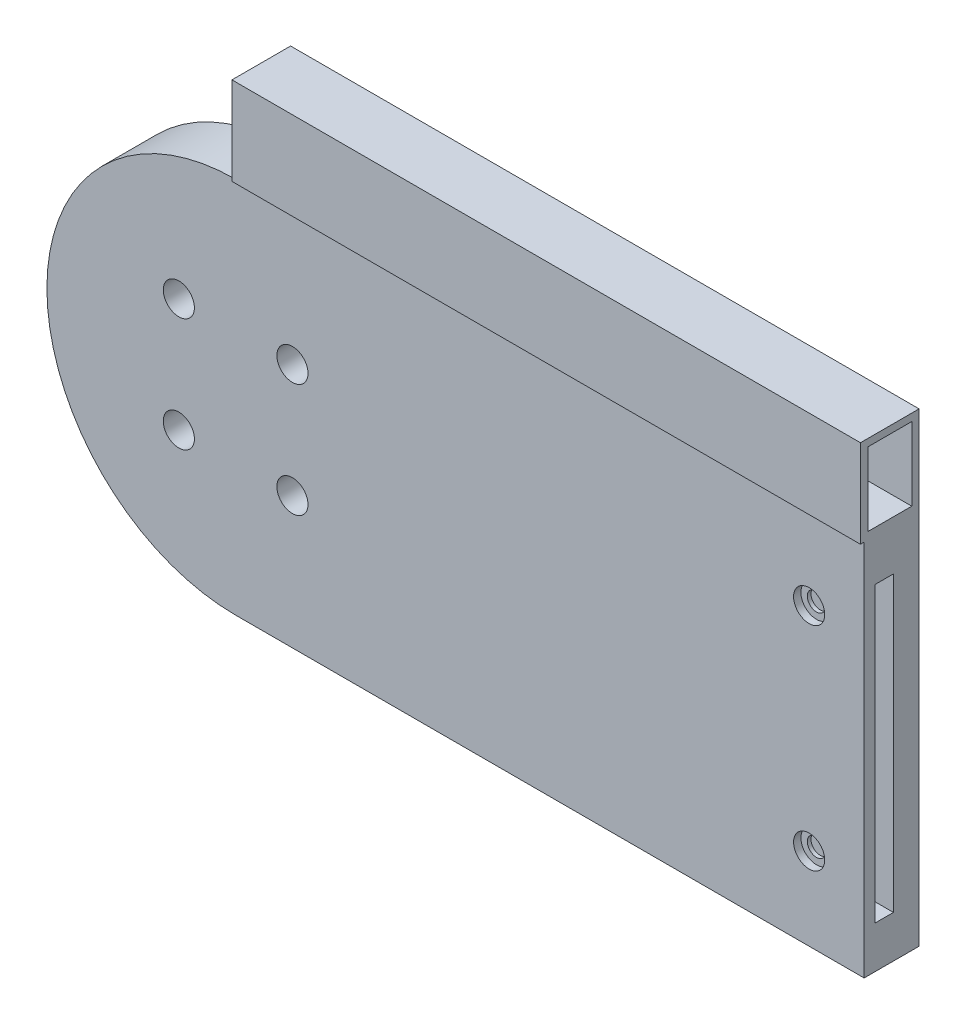
from build123d import *

# Parameters (mm, degrees)
CROQUIS1_W                        = 103
CROQUIS1_H                        = 103
CROQUIS1_R                        = 2.5
SALIENTE_EXTRUIR1_DEPTH           = 15
REDONDEO2_R                       = 51.5
CROQUIS2_W                        = 15
CROQUIS2_H                        = 103
SALIENTE_EXTRUIR2_DEPTH           = 120
CROQUIS3_R                        = 4.25
CORTAR_EXTRUIR1_DEPTH             = 8
SALIENTE_EXTRUIR3_START           = -223
SALIENTE_EXTRUIR3_DEPTH           = 223
CORTAR_EXTRUIR2_DEPTH             = 181.53669987
CORTAR_EXTRUIR2_DEPTH_BACK        = 181.53669987
REDONDEO3_START                   = -23.965772234
REDONDEO3_DEPTH                   = 195.465772234
REDONDEO3_START_2                 = -45.024993159
REDONDEO3_2_DEPTH                 = 21.059220925
REDONDEO3_START_3                 = 15
REDONDEO3_3_DEPTH                 = 9
REDONDEO4_R                       = 10
CORTAR_EXTRUIR3_REACH             = 182.537
CROQUIS6_R                        = 4.25
CORTAR_EXTRUIR3_DIRECTION_2_DEPTH = 181.536699978
CORTAR_EXTRUIR4_DEPTH             = 231.022281636
CORTAR_EXTRUIR4_DEPTH_BACK        = 40
CROQUIS7_W                        = 5
CROQUIS7_H                        = 80
CROQUIS10_R                       = 4.25
CORTAR_EXTRUIR5_DEPTH             = 10
CROQUIS11_R                       = 2.5
CORTAR_EXTRUIR6_DEPTH             = 180.536904387
CROQUIS12_W                       = 16
CROQUIS12_H                       = 24
CROQUIS12_W_2                     = 12
CROQUIS12_H_2                     = 20
SALIENTE_EXTRUIR4_DEPTH           = 171.5
CORTAR_EXTRUIR7_DEPTH             = 4
CROQUIS14_W                       = 237.415318392
CROQUIS14_H                       = 103
CORTAR_EXTRUIR8_DEPTH             = 8


with BuildPart() as part:
    # Croquis1 → Saliente-Extruir1 (new body)
    with BuildSketch(Plane.XY):
        Rectangle(CROQUIS1_W, CROQUIS1_H)
        with Locations((15.5, 15.5)):
            Circle(CROQUIS1_R, mode=Mode.SUBTRACT)
        with Locations((-15.5, 15.5)):
            Circle(CROQUIS1_R, mode=Mode.SUBTRACT)
        with Locations((-15.5, -15.5)):
            Circle(CROQUIS1_R, mode=Mode.SUBTRACT)
        with Locations((15.5, -15.5)):
            Circle(CROQUIS1_R, mode=Mode.SUBTRACT)
    extrude(amount=SALIENTE_EXTRUIR1_DEPTH)

    # Redondeo2
    redondeo2_edges = [part.edges().sort_by_distance(p)[0] for p in [
        (-51.5, -51.5, 7.5),
        (-51.5, 51.5, 7.5),
    ]]
    fillet(redondeo2_edges, radius=REDONDEO2_R - 0.0001)  # a hair under: the kernel refuses the full size

    # Croquis2 → Saliente-Extruir2 (add)
    with BuildSketch(Plane(origin=(51.5, 0, 0), x_dir=(0, 0, -1), z_dir=(1, 0, 0))):
        with Locations((-7.5, 0)):
            Rectangle(CROQUIS2_W, CROQUIS2_H)
    extrude(amount=SALIENTE_EXTRUIR2_DEPTH)

    # Croquis3 → Cortar-Extruir1 (cut)
    with BuildSketch(Plane.XY.offset(15)):
        with Locations((-15.5, 15.5)):
            Circle(CROQUIS3_R)
        with Locations((15.5, 15.5)):
            Circle(CROQUIS3_R)
        with Locations((15.5, -15.5)):
            Circle(CROQUIS3_R)
        with Locations((-15.5, -15.5)):
            Circle(CROQUIS3_R)
    extrude(amount=-CORTAR_EXTRUIR1_DEPTH, mode=Mode.SUBTRACT)

    # Croquis4 → Saliente-Extruir3 (add)
    with BuildSketch(Plane(origin=(171.5, 0, 0), x_dir=(0, 0, -1), z_dir=(1, 0, 0)).offset(SALIENTE_EXTRUIR3_START)):
        Polygon((-15, -19), (-15, -25), (-23, -25), (-23, 25), (-15, 25), (-15, 19), (-19, 19), (-19, -19), align=None)
    extrude(amount=SALIENTE_EXTRUIR3_DEPTH)

    # Croquis5 → Cortar-Extruir2 (cut, two sides: drawn at the far end of the back side and taken through both)
    with BuildSketch(Plane(origin=(0, 0, 0), x_dir=(-1, 0, 0), z_dir=(0, 0, -1)).offset(-CORTAR_EXTRUIR2_DEPTH_BACK)):
        with BuildLine():
            Line((40.930864284, 31.255629077), (61.422564692, 30.315306135))
            Line((61.422564692, 30.315306135), (63.075048064, -35.056936027))
            Line((63.075048064, -35.056936027), (38.432028807, -34.281615507))
            ThreePointArc((38.432028807, -34.281615507), (48.122237498, -18.343943366), (51.5, 0))
            ThreePointArc((51.5, 0), (48.786214808, 16.497128377), (40.930864284, 31.255629077))
        make_face()
    extrude(amount=CORTAR_EXTRUIR2_DEPTH + CORTAR_EXTRUIR2_DEPTH_BACK, mode=Mode.SUBTRACT)

    # Redondeo3: read off the stored shape, not the designer's step
    # Redondeo3 outline → Redondeo3 (add)
    with BuildSketch(Plane.YZ.offset(REDONDEO3_START)):
        with BuildLine():
            Line((-25, 15), (-25, 23))
            ThreePointArc((-25, 23), (-28.473403651, 17.254033308), (-34.797958971, 15))
            Line((-34.797958971, 15), (-25, 15))
        make_face()
        with BuildLine():
            ThreePointArc((34.797958971, 15), (28.473403651, 17.254033308), (25, 23))
            Line((25, 23), (25, 15))
            Line((25, 15), (34.797958971, 15))
        make_face()
    extrude(amount=REDONDEO3_DEPTH)

    # Redondeo3 2 outline → Redondeo3 2 (add)
    with BuildSketch(Plane.YZ.offset(REDONDEO3_START_2)):
        with BuildLine():
            ThreePointArc((34.797958971, 15), (28.473403651, 17.254033308), (25, 23))
            Line((25, 23), (25, 15))
            Line((25, 15), (34.797958971, 15))
        make_face()
        with BuildLine():
            Line((-25, 15), (-25, 23))
            ThreePointArc((-25, 23), (-28.473403651, 17.254033308), (-34.797958971, 15))
            Line((-34.797958971, 15), (-25, 15))
        make_face()
    extrude(amount=REDONDEO3_2_DEPTH)

    # Redondeo3 3 outline → Redondeo3 3 (cut)
    with BuildSketch(Plane.XY.offset(REDONDEO3_START_3)):
        with BuildLine():
            Line((-45.024993159, -36), (-36.827299657, -36))
            ThreePointArc((-36.827299657, -36), (-41.294060795, -30.774186311), (-45.024993083, -24.999999958))
            Line((-45.024993083, -24.999999958), (-45.024993159, -36))
        make_face()
        with BuildLine():
            Line((-45.024993159, 36), (-45.024993083, 24.999999958))
            ThreePointArc((-45.024993083, 24.999999958), (-41.294060795, 30.774186311), (-36.827299657, 36))
            Line((-36.827299657, 36), (-45.024993159, 36))
        make_face()
    extrude(amount=REDONDEO3_3_DEPTH, mode=Mode.SUBTRACT)

    # Redondeo4
    redondeo4_edges = [part.edges().sort_by_distance(p)[0] for p in [
        (63.237503445, -25, 23),
        (63.237503445, 25, 23),
    ]]
    fillet(redondeo4_edges, radius=REDONDEO4_R)

    # Croquis6 → Cortar-Extruir3 (cut, up to next)
    with BuildSketch(Plane.XY.offset(23), mode=Mode.PRIVATE) as cortar_extruir3_sk1:
        with Locations((15.5, 15.5)):
            Circle(CROQUIS6_R)
    cortar_extruir3_tool1 = extrude(cortar_extruir3_sk1.sketch, amount=-CORTAR_EXTRUIR3_REACH, mode=Mode.PRIVATE) & part.part
    # Croquis6 → Cortar-Extruir3 (cut, up to next)
    with BuildSketch(Plane.XY.offset(23), mode=Mode.PRIVATE) as cortar_extruir3_sk2:
        with Locations((-15.5, 15.5)):
            Circle(CROQUIS6_R)
    cortar_extruir3_tool2 = extrude(cortar_extruir3_sk2.sketch, amount=-CORTAR_EXTRUIR3_REACH, mode=Mode.PRIVATE) & part.part
    # Croquis6 → Cortar-Extruir3 (cut, up to next)
    with BuildSketch(Plane.XY.offset(23), mode=Mode.PRIVATE) as cortar_extruir3_sk3:
        with Locations((15.5, -15.5)):
            Circle(CROQUIS6_R)
    cortar_extruir3_tool3 = extrude(cortar_extruir3_sk3.sketch, amount=-CORTAR_EXTRUIR3_REACH, mode=Mode.PRIVATE) & part.part
    # Croquis6 → Cortar-Extruir3 (cut, up to next)
    with BuildSketch(Plane.XY.offset(23), mode=Mode.PRIVATE) as cortar_extruir3_sk4:
        with Locations((-15.5, -15.5)):
            Circle(CROQUIS6_R)
    cortar_extruir3_tool4 = extrude(cortar_extruir3_sk4.sketch, amount=-CORTAR_EXTRUIR3_REACH, mode=Mode.PRIVATE) & part.part
    add(cortar_extruir3_tool1.solids().sort_by_distance((15.5, 15.5, 23))[0], mode=Mode.SUBTRACT)
    add(cortar_extruir3_tool2.solids().sort_by_distance((-15.5, 15.5, 23))[0], mode=Mode.SUBTRACT)
    add(cortar_extruir3_tool3.solids().sort_by_distance((15.5, -15.5, 23))[0], mode=Mode.SUBTRACT)
    add(cortar_extruir3_tool4.solids().sort_by_distance((-15.5, -15.5, 23))[0], mode=Mode.SUBTRACT)

    # Croquis6 → Cortar-Extruir3 direction 2 (cut)
    with BuildSketch(Plane.XY.offset(23)):
        with Locations((15.5, 15.5)):
            Circle(CROQUIS6_R)
        with Locations((-15.5, 15.5)):
            Circle(CROQUIS6_R)
        with Locations((15.5, -15.5)):
            Circle(CROQUIS6_R)
        with Locations((-15.5, -15.5)):
            Circle(CROQUIS6_R)
    extrude(amount=CORTAR_EXTRUIR3_DIRECTION_2_DEPTH, mode=Mode.SUBTRACT)

    # Croquis7 → Cortar-Extruir4 (cut, two sides: drawn at the far end of the back side and taken through both)
    with BuildSketch(Plane(origin=(171.5, 0, 0), x_dir=(0, 0, -1), z_dir=(1, 0, 0)).offset(-CORTAR_EXTRUIR4_DEPTH_BACK)):
        with Locations((-9.5, 0)):
            Rectangle(CROQUIS7_W, CROQUIS7_H)
    extrude(amount=CORTAR_EXTRUIR4_DEPTH + CORTAR_EXTRUIR4_DEPTH_BACK, mode=Mode.SUBTRACT)

    # Croquis10 → Cortar-Extruir5 (cut)
    with BuildSketch(Plane.XY.offset(23)):
        with Locations((156.5, 29)):
            Circle(CROQUIS10_R)
        with Locations(Location((156.5, -29, 0), (0, 0, 31.206732466))):
            Circle(CROQUIS10_R)
    extrude(amount=-CORTAR_EXTRUIR5_DEPTH, mode=Mode.SUBTRACT)

    # Croquis11 → Cortar-Extruir6 (cut, through all)
    with BuildSketch(Plane.XY.offset(13)):
        with Locations((156.5, 29)):
            Circle(CROQUIS11_R)
        with Locations((156.5, -29)):
            Circle(CROQUIS11_R)
    extrude(amount=-CORTAR_EXTRUIR6_DEPTH, mode=Mode.SUBTRACT)

    # Croquis12 → Saliente-Extruir4 (add)
    with BuildSketch(Plane(origin=(171.5, 0, 0), x_dir=(0, 0, -1), z_dir=(1, 0, 0))):
        with Locations((-8, 63.5)):
            Rectangle(CROQUIS12_W, CROQUIS12_H)
        with Locations((-8, 63.5)):
            Rectangle(CROQUIS12_W_2, CROQUIS12_H_2, mode=Mode.SUBTRACT)
    extrude(amount=-SALIENTE_EXTRUIR4_DEPTH)

    # Croquis13 → Cortar-Extruir7 (cut)
    with BuildSketch(Plane(origin=(0, 0, 0), x_dir=(-1, 0, 0), z_dir=(0, 0, -1))):
        Polygon((-156.5, 24.381197846), (-152.5, 26.690598923), (-152.5, 31.309401077), (-156.5, 33.618802154), (-160.5, 31.309401077), (-160.5, 26.690598923), align=None)
        Polygon((-152.5, -26.690598923), (-156.5, -24.381197846), (-160.5, -26.690598923), (-160.5, -31.309401077), (-156.5, -33.618802154), (-152.5, -31.309401077), align=None)
    extrude(amount=-CORTAR_EXTRUIR7_DEPTH, mode=Mode.SUBTRACT)

    # Croquis14 → Cortar-Extruir8 (cut)
    with BuildSketch(Plane.XY.offset(23)):
        with Locations((52.792340804, 0)):
            Rectangle(CROQUIS14_W, CROQUIS14_H)
    extrude(amount=-CORTAR_EXTRUIR8_DEPTH, mode=Mode.SUBTRACT)


solid = part.part
